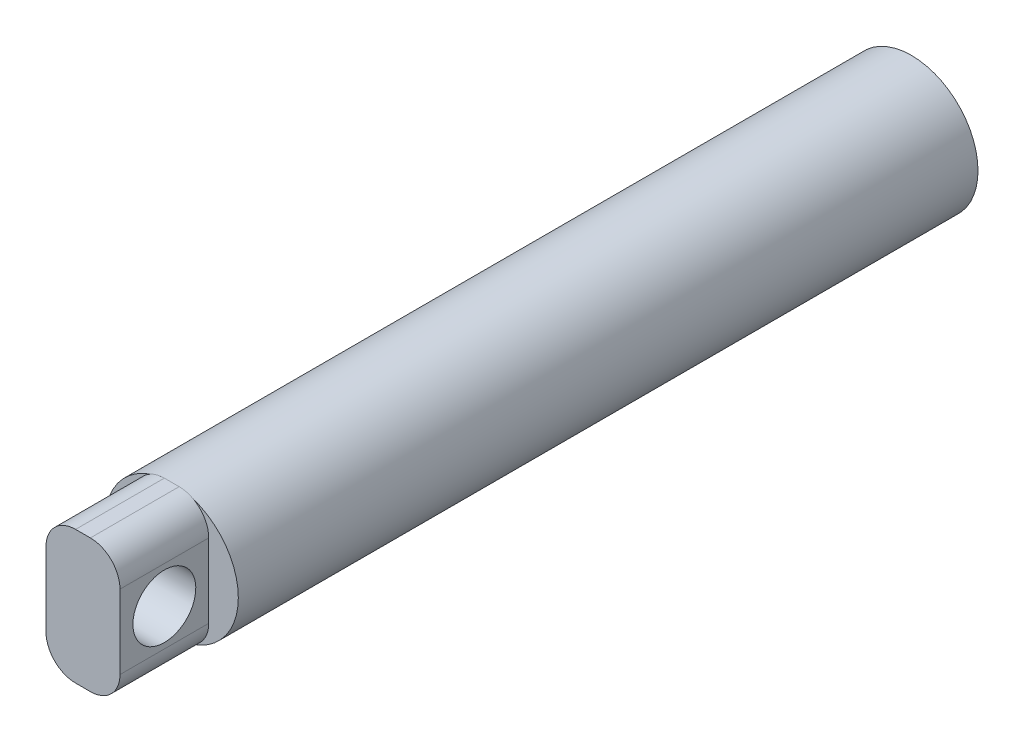
from build123d import *

# Parameters (mm, degrees)
ESBO_O1_R                = 4.5
RESSALTO_EXTRUS_O1_DEPTH = 50
ESBO_O2_W                = 5
ESBO_O2_H                = 9
RESSALTO_EXTRUS_O2_DEPTH = 6
FILETE1_R                = 2
ESBO_O3_R                = 2.125
CORTE_EXTRUS_O1_DEPTH    = 6


with BuildPart() as part:
    # Esboço1 → Ressalto-extrusão1 (new body)
    with BuildSketch(Plane.XY):
        Circle(ESBO_O1_R)
    extrude(amount=RESSALTO_EXTRUS_O1_DEPTH)

    # Esboço2 → Ressalto-extrusão2 (add)
    with BuildSketch(Plane.XY.offset(50)):
        Rectangle(ESBO_O2_W, ESBO_O2_H)
    extrude(amount=RESSALTO_EXTRUS_O2_DEPTH)

    # Filete1
    # the kernel refuses this fillet: 2 mm, written as the material it takes off along each edge
    with BuildSketch(Plane(origin=(2.5, -4.5, 50), x_dir=(0, 1, 0), z_dir=(0, 0, 1)), Plane(origin=(-2.5, 4.5, 50), x_dir=(0, -1, 0), z_dir=(0, 0, 1)), Plane(origin=(-2.5, -4.5, 50), x_dir=(1, 0, 0), z_dir=(0, 0, 1))) as filete1_piece_1:
        with BuildLine():
            CenterArc((FILETE1_R, FILETE1_R), FILETE1_R, 180, 90)
            Line((0, FILETE1_R), (0, 0))
            Line((0, 0), (FILETE1_R, 0))
        make_face()
    extrude(amount=11, mode=Mode.SUBTRACT)
    with BuildSketch(Plane(origin=(2.5, 4.5, 50), x_dir=(0, -1, 0), z_dir=(0, 0, 1))) as filete1_piece_2:
        with BuildLine():
            CenterArc((FILETE1_R, -FILETE1_R), FILETE1_R, 90, 90)
            Line((0, -FILETE1_R), (0, 0))
            Line((0, 0), (FILETE1_R, 0))
        make_face()
    extrude(amount=11, mode=Mode.SUBTRACT)

    # Esboço3 → Corte-extrusão1 (cut)
    with BuildSketch(Plane.ZY.offset(2.5)):
        with Locations(Location((53, 0, 0), (0, 0, 270))):
            Circle(ESBO_O3_R)
    extrude(amount=-CORTE_EXTRUS_O1_DEPTH, mode=Mode.SUBTRACT)


solid = part.part
